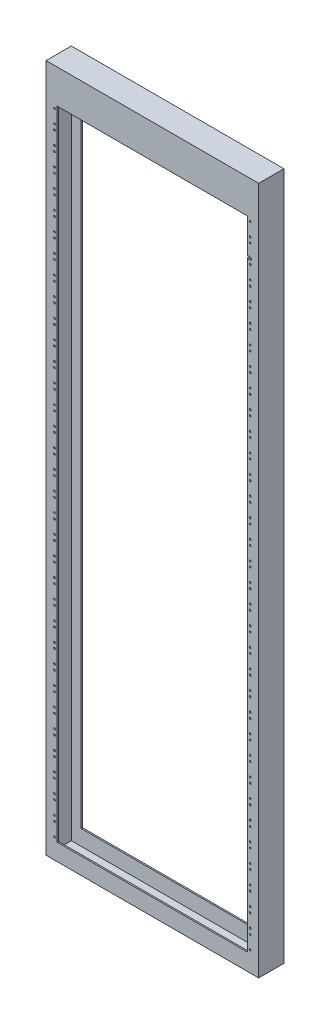
from build123d import *

# Parameters (mm, degrees)
SKETCH1_W                           = 505
SKETCH1_H                           = 1634.9
SKETCH1_W_2                         = 452
SKETCH1_H_2                         = 1514.4
BOSS_EXTRUDE1_DEPTH                 = 60
SHELL1_T                            = -3.175
TAP_DRILL_FOR_M5X0_8_TAP1_D         = 4.2
TAP_DRILL_FOR_M5X0_8_TAP1_DEPTH     = 19.05
TAP_DRILL_FOR_M5X0_8_TAP1_TIP       = 1.2618073
TAP_DRILL_SLOT_FOR_10_24_TAP1_DEPTH = 60


# Read off the part's stored shape, not the designer's step: Tap Drill Slot for #10-24 Tap1
with BuildPart() as part:
    # Sketch1 → Boss-Extrude1 (new body)
    with BuildSketch(Plane.XY):
        with Locations((226, 777.45)):
            Rectangle(SKETCH1_W, SKETCH1_H)
        with Locations((226, 757.2)):
            Rectangle(SKETCH1_W_2, SKETCH1_H_2, mode=Mode.SUBTRACT)
    extrude(amount=BOSS_EXTRUDE1_DEPTH)

    # Shell1
    shell1_openings = [part.faces().sort_by_distance(p)[0] for p in [
        (0, 757.2, 30),
        (226, 0, 30),
        (452, 757.2, 30),
        (226, 1514.4, 30),
    ]]
    offset(amount=SHELL1_T, openings=shell1_openings, kind=Kind.INTERSECTION)

    # Tap Drill for M5x0.8 Tap1
    with Locations(Plane.XY.offset(60)):
        with Locations((-6.5, 1506.5), (-6.5, 1474.75), (-6.5, 1462.05), (-6.5, 1430.3), (-6.5, 1417.6), (-6.5, 1385.85), (-6.5, 1373.15), (-6.5, 1341.4), (-6.5, 1328.7), (-6.5, 1296.95), (-6.5, 1284.25), (-6.5, 1252.5), (-6.5, 1239.8), (-6.5, 1208.05), (-6.5, 1195.35), (-6.5, 1163.6), (-6.5, 1150.9), (-6.5, 1119.15), (-6.5, 1106.45), (-6.5, 1074.7), (-6.5, 1062), (-6.5, 1030.25), (-6.5, 1017.55), (-6.5, 985.8), (-6.5, 973.1), (-6.5, 941.35), (-6.5, 928.65), (-6.5, 896.9), (-6.5, 884.2), (-6.5, 852.45), (-6.5, 839.75), (-6.5, 808), (-6.5, 795.3), (-6.5, 763.55), (-6.5, 750.85), (-6.5, 719.1), (-6.5, 706.4), (-6.5, 674.65), (-6.5, 661.95), (-6.5, 630.2), (-6.5, 617.5), (-6.5, 585.75), (-6.5, 573.05), (-6.5, 541.3), (-6.5, 528.6), (-6.5, 496.85), (-6.5, 484.15), (-6.5, 452.4), (-6.5, 439.7), (-6.5, 407.95), (-6.5, 395.25), (-6.5, 363.5), (-6.5, 350.8), (-6.5, 319.05), (-6.5, 306.35), (-6.5, 274.6), (-6.5, 261.9), (-6.5, 230.15), (-6.5, 217.45), (-6.5, 185.7), (-6.5, 173), (-6.5, 141.25), (-6.5, 128.55), (-6.5, 96.8), (-6.5, 84.1), (-6.5, 52.35), (-6.5, 39.65), (-6.5, 7.9), (458.5, 7.9), (458.5, 39.65), (458.5, 52.35), (458.5, 84.1), (458.5, 96.8), (458.5, 128.55), (458.5, 141.25), (458.5, 173), (458.5, 185.7), (458.5, 217.45), (458.5, 230.15), (458.5, 261.9), (458.5, 274.6), (458.5, 306.35), (458.5, 319.05), (458.5, 350.8), (458.5, 363.5), (458.5, 395.25), (458.5, 407.95), (458.5, 439.7), (458.5, 452.4), (458.5, 484.15), (458.5, 496.85), (458.5, 528.6), (458.5, 541.3), (458.5, 573.05), (458.5, 585.75), (458.5, 617.5), (458.5, 630.2), (458.5, 661.95), (458.5, 674.65), (458.5, 706.4), (458.5, 719.1), (458.5, 750.85), (458.5, 763.55), (458.5, 795.3), (458.5, 808), (458.5, 839.75), (458.5, 852.45), (458.5, 884.2), (458.5, 896.9), (458.5, 928.65), (458.5, 941.35), (458.5, 973.1), (458.5, 985.8), (458.5, 1017.55), (458.5, 1030.25), (458.5, 1062), (458.5, 1074.7), (458.5, 1106.45), (458.5, 1119.15), (458.5, 1150.9), (458.5, 1163.6), (458.5, 1195.35), (458.5, 1208.05), (458.5, 1239.8), (458.5, 1252.5), (458.5, 1284.25), (458.5, 1296.95), (458.5, 1328.7), (458.5, 1341.4), (458.5, 1373.15), (458.5, 1385.85), (458.5, 1417.6), (458.5, 1430.3), (458.5, 1462.05), (458.5, 1474.75), (458.5, 1506.5)):
            Hole(TAP_DRILL_FOR_M5X0_8_TAP1_D / 2, depth=TAP_DRILL_FOR_M5X0_8_TAP1_DEPTH)
            with Locations((0, 0, -(TAP_DRILL_FOR_M5X0_8_TAP1_DEPTH + TAP_DRILL_FOR_M5X0_8_TAP1_TIP / 2))):  # 118° drill point
                Cone(0, TAP_DRILL_FOR_M5X0_8_TAP1_D / 2, TAP_DRILL_FOR_M5X0_8_TAP1_TIP, mode=Mode.SUBTRACT)

    # Tap Drill Slot for #10-24 Tap1 outline → Tap Drill Slot for #10-24 Tap1 (cut)
    with BuildSketch(Plane.XY):
        with BuildLine():
            ThreePointArc((458.496999774, 1427.125), (461.671999774, 1430.3), (458.496999774, 1433.475))
            Line((458.496999774, 1433.475), (454.686999774, 1433.475))
            ThreePointArc((454.686999774, 1433.475), (453.152301776, 1433.079447257), (452, 1431.991347751))
            Line((452, 1431.991347751), (452, 1428.608652249))
            ThreePointArc((452, 1428.608652249), (453.152301776, 1427.520552743), (454.686999774, 1427.125))
            Line((454.686999774, 1427.125), (458.496999774, 1427.125))
        make_face()
    extrude(amount=TAP_DRILL_SLOT_FOR_10_24_TAP1_DEPTH, mode=Mode.SUBTRACT)


solid = part.part
